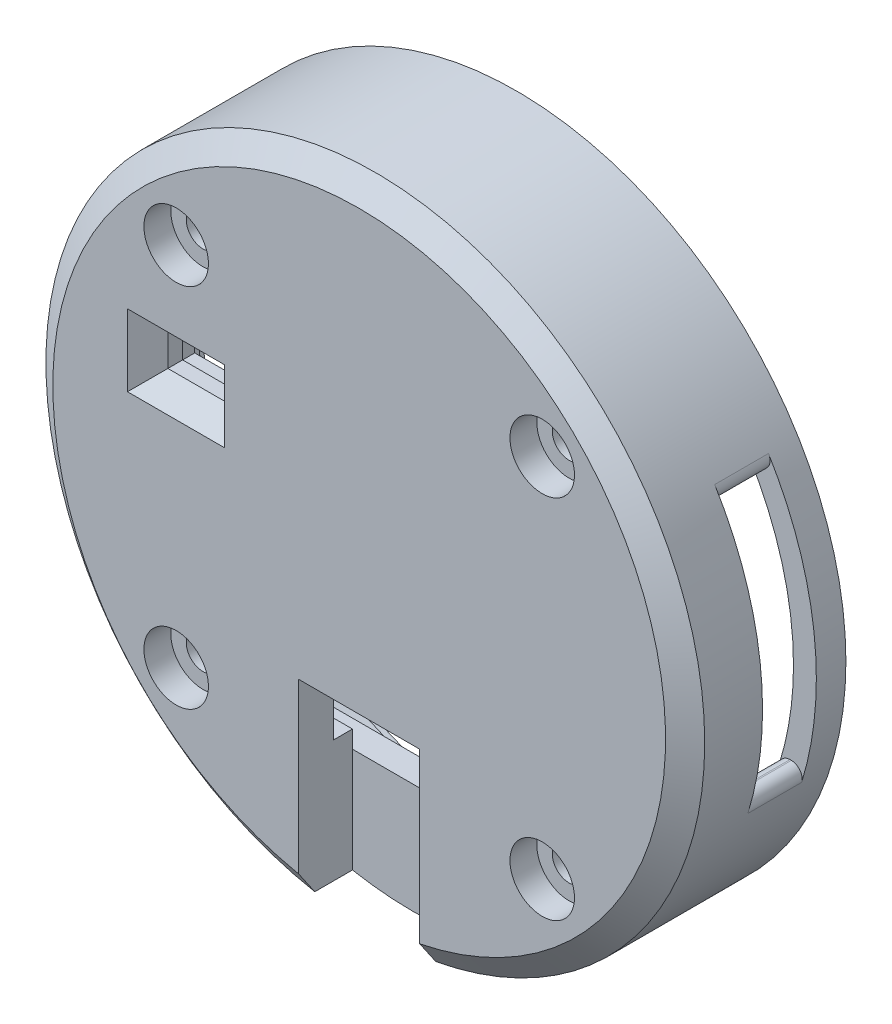
from build123d import *
from build123d.topology import SkipClean

# Parameters (mm, degrees)
EXTRUDE_3_DEPTH     = 11.7
SKETCH_2_5_R        = 23.6
SKETCH_2_5_R_2      = 22.8
EXTRUDE_4_DEPTH     = 10.7
SKETCH_2_6_R        = 2.6
SKETCH_2_6_W        = 4.2
SKETCH_2_6_H        = 2.343935591
EXTRUDE_5_DEPTH     = 2.6
EXTRUDE_6_DEPTH     = 4
SKETCH_2_9_R        = 2.6
SKETCH_2_9_R_2      = 1.25
SKETCH_2_9_R_3      = 2.4
SKETCH_2_9_W        = 8.7
SKETCH_2_9_H        = 5.343935591
SKETCH_2_9_W_2      = 6.7
SKETCH_2_9_H_2      = 3.343935591
EXTRUDE_7_DEPTH     = 4
EXTRUDE_8_DEPTH     = 6
EXTRUDE_10_DEPTH    = 8.6
CUT_EXTRUDE_1_DEPTH = 4
CUT_EXTRUDE_2_DEPTH = 9.5
EXTRUDE_9_DEPTH     = 5.5
SKETCH_2_15_R       = 2.4
SKETCH_2_15_R_2     = 1.25
CUT_EXTRUDE_3_DEPTH = 2
CHAMFER_2_SIZE      = 1.5
FILLET_2_R          = 0.8
FILLET_3_R          = 0.8
FILLET_4_R          = 0.8
FILLET_5_R          = 0.8
CHAMFER_3_SIZE      = 1.2
CHAMFER_3_SIZE2     = 1.713777608


with BuildPart() as part:
    # 草图2 → 凸台-拉伸3 (new body)
    with BuildSketch(Plane.XY):
        with BuildLine():
            ThreePointArc((21.633307653, 11.5), (-14.000099508, 20.105899974), (-18.290981384, -16.3))
            Line((-18.290981384, -16.3), (-17.066634115, -16.3))
            ThreePointArc((-17.066634115, -16.3), (-14.012358538, 18.989834339), (20.608493395, 11.5))
            Line((20.608493395, 11.5), (21.633307653, 11.5))
        make_face()
        with BuildLine():
            ThreePointArc((24.5, 0), (23.772526554, 5.925958256), (21.633307653, 11.5))
            Line((21.633307653, 11.5), (20.608493395, 11.5))
            ThreePointArc((20.608493395, 11.5), (22.839882269, 5.941361624), (23.6, 0))
            ThreePointArc((23.6, 0), (23.391840542, -3.1275863), (22.771034232, -6.2))
            Line((22.771034232, -6.2), (23.70253151, -6.2))
            ThreePointArc((23.70253151, -6.2), (24.29981504, -3.125538193), (24.5, 0))
        make_face()
        with BuildLine():
            ThreePointArc((18.290981384, -16.3), (21.595515305, -11.570813225), (23.70253151, -6.2))
            Line((23.70253151, -6.2), (22.771034232, -6.2))
            ThreePointArc((22.771034232, -6.2), (20.549025642, -11.605927157), (17.066634115, -16.3))
            Line((17.066634115, -16.3), (18.290981384, -16.3))
        make_face()
        with BuildLine():
            Line((4.5, -23.167002396), (4.5, -24.083189158))
            ThreePointArc((4.5, -24.083189158), (12.041665852, -21.336548069), (18.290981384, -16.3))
            Line((18.290981384, -16.3), (17.066634115, -16.3))
            ThreePointArc((17.066634115, -16.3), (11.316751178, -20.709687172), (4.5, -23.167002396))
        make_face()
        with BuildLine():
            Line((-4.5, -23.167002396), (-4.5, -24.083189158))
            ThreePointArc((-4.5, -24.083189158), (0, -24.5), (4.5, -24.083189158))
            Line((4.5, -24.083189158), (4.5, -23.167002396))
            ThreePointArc((4.5, -23.167002396), (0, -23.6), (-4.5, -23.167002396))
        make_face()
        with BuildLine():
            Line((-17.066634115, -16.3), (-18.290981384, -16.3))
            ThreePointArc((-18.290981384, -16.3), (-12.041665852, -21.336548069), (-4.5, -24.083189158))
            Line((-4.5, -24.083189158), (-4.5, -23.167002396))
            ThreePointArc((-4.5, -23.167002396), (-11.316751178, -20.709687172), (-17.066634115, -16.3))
        make_face()
    extrude(amount=-EXTRUDE_3_DEPTH)

    # 草图2<5> → 凸台-拉伸4 (add)
    with BuildSketch(Plane.XY):
        Circle(SKETCH_2_5_R)
        Circle(SKETCH_2_5_R_2, mode=Mode.SUBTRACT)
    extrude(amount=-EXTRUDE_4_DEPTH)

    # 草图2<6> → 凸台-拉伸5 (add)
    with BuildSketch(Plane.XY):
        with BuildLine():
            ThreePointArc((17.170905626, -15), (0, 22.8), (-17.170905626, -15))
            Line((-17.170905626, -15), (-15.810194979, -15))
            ThreePointArc((-15.810194979, -15), (-13.611805538, -11.011805538), (-11.413416097, -15))
            Line((-11.413416097, -15), (-4.5, -15))
            Line((-4.5, -15), (-4.5, -9.8))
            Line((-4.5, -9.8), (4.5, -9.8))
            Line((4.5, -9.8), (4.5, -15))
            Line((4.5, -15), (11.413416097, -15))
            ThreePointArc((11.413416097, -15), (13.611805538, -11.011805538), (15.810194979, -15))
            Line((15.810194979, -15), (17.170905626, -15))
        make_face()
        with Locations((-13.611805538, 13.611805538)):
            Circle(SKETCH_2_6_R, mode=Mode.SUBTRACT)
        with Locations((13.611805538, 13.611805538)):
            Circle(SKETCH_2_6_R, mode=Mode.SUBTRACT)
        with Locations((-13.63048294, 5.028032205)):
            Rectangle(SKETCH_2_6_W, SKETCH_2_6_H, mode=Mode.SUBTRACT)
    extrude(amount=-EXTRUDE_5_DEPTH)

    # 草图2<7> → 凸台-拉伸6 (add)
    with BuildSketch(Plane.XY):
        with BuildLine():
            ThreePointArc((-17.170905626, -15), (-16.569248581, -15.662056106), (-15.942082674, -16.3))
            Line((-15.942082674, -16.3), (-4.5, -16.3))
            Line((-4.5, -16.3), (-4.5, -15))
            Line((-4.5, -15), (-11.413416097, -15))
            ThreePointArc((-11.413416097, -15), (-13.611805538, -16.211805538), (-15.810194979, -15))
            Line((-15.810194979, -15), (-17.170905626, -15))
        make_face()
        with BuildLine():
            Line((4.5, -15), (4.5, -16.3))
            Line((4.5, -16.3), (15.942082674, -16.3))
            ThreePointArc((15.942082674, -16.3), (16.569248581, -15.662056106), (17.170905626, -15))
            Line((17.170905626, -15), (15.810194979, -15))
            ThreePointArc((15.810194979, -15), (13.611805538, -16.211805538), (11.413416097, -15))
            Line((11.413416097, -15), (4.5, -15))
        make_face()
    extrude(amount=-EXTRUDE_6_DEPTH)

    # 草图2<9> → 凸台-拉伸7 (add)
    # profile 1 of 9: a face of its own
    with BuildSketch(Plane.XY):
        with Locations((-13.611805538, 13.611805538)):
            Circle(SKETCH_2_9_R)
        with Locations((-13.611805538, 13.611805538)):
            Circle(SKETCH_2_9_R_2, mode=Mode.SUBTRACT)
    # profile 2 of 9: a face of its own
    with BuildSketch(Plane.XY):
        with Locations((13.611805538, 13.611805538)):
            Circle(SKETCH_2_9_R)
        with Locations((13.611805538, 13.611805538)):
            Circle(SKETCH_2_9_R_2, mode=Mode.SUBTRACT)
    # profile 3 of 9: a face of its own
    with BuildSketch(Plane.XY):
        with Locations((-13.611805538, 13.611805538)):
            Circle(SKETCH_2_9_R)
        with Locations((-13.611805538, 13.611805538)):
            Circle(SKETCH_2_9_R_3, mode=Mode.SUBTRACT)
    # profile 4 of 9: a face of its own
    with BuildSketch(Plane.XY):
        with Locations((13.611805538, 13.611805538)):
            Circle(SKETCH_2_9_R)
        with Locations((13.611805538, 13.611805538)):
            Circle(SKETCH_2_9_R_3, mode=Mode.SUBTRACT)
    # profile 5 of 9: a face of its own
    with BuildSketch(Plane.XY):
        with Locations((13.611805538, -13.611805538)):
            Circle(SKETCH_2_9_R)
        with Locations((13.611805538, -13.611805538)):
            Circle(SKETCH_2_9_R_3, mode=Mode.SUBTRACT)
    # profile 6 of 9: a face of its own
    with BuildSketch(Plane.XY):
        with Locations((-13.611805538, -13.611805538)):
            Circle(SKETCH_2_9_R)
        with Locations((-13.611805538, -13.611805538)):
            Circle(SKETCH_2_9_R_3, mode=Mode.SUBTRACT)
    # profile 7 of 9: a face of its own
    with BuildSketch(Plane.XY):
        with Locations((-13.611805538, -13.611805538)):
            Circle(SKETCH_2_9_R_3)
        with Locations((-13.611805538, -13.611805538)):
            Circle(SKETCH_2_9_R_2, mode=Mode.SUBTRACT)
    # profile 8 of 9: a face of its own
    with BuildSketch(Plane.XY):
        with Locations((13.611805538, -13.611805538)):
            Circle(SKETCH_2_9_R_3)
        with Locations((13.611805538, -13.611805538)):
            Circle(SKETCH_2_9_R_2, mode=Mode.SUBTRACT)
    # profile 9 of 9: a face of its own
    with BuildSketch(Plane.XY):
        with Locations((-12.88048294, 5.028032205)):
            Rectangle(SKETCH_2_9_W, SKETCH_2_9_H)
        with Locations((-12.88048294, 5.028032205)):
            Rectangle(SKETCH_2_9_W_2, SKETCH_2_9_H_2, mode=Mode.SUBTRACT)
    extrude(amount=-EXTRUDE_7_DEPTH)

    # 草图2<11> → 凸台-拉伸8 (add)
    with BuildSketch(Plane.XY):
        with BuildLine():
            ThreePointArc((-15.942082674, -16.3), (-9.833120113, -20.570603998), (-2.673250745, -22.642741231))
            Line((-2.673250745, -22.642741231), (-3.766025404, -20.75))
            ThreePointArc((-3.766025404, -20.75), (-3.766025404, -19.75), (-2.9, -19.25))
            Line((-2.9, -19.25), (2.9, -19.25))
            ThreePointArc((2.9, -19.25), (3.766025404, -19.75), (3.766025404, -20.75))
            Line((3.766025404, -20.75), (2.673250745, -22.642741231))
            ThreePointArc((2.673250745, -22.642741231), (9.833120113, -20.570603998), (15.942082674, -16.3))
            Line((15.942082674, -16.3), (-15.942082674, -16.3))
        make_face()
    extrude(amount=-EXTRUDE_8_DEPTH)

    # 草图2<17> → 凸台-拉伸10 (add)
    with BuildSketch(Plane.XY):
        with BuildLine():
            Line((-3.766025404, -20.75), (-2.673250745, -22.642741231))
            ThreePointArc((-2.673250745, -22.642741231), (0, -22.8), (2.673250745, -22.642741231))
            Line((2.673250745, -22.642741231), (3.766025404, -20.75))
            ThreePointArc((3.766025404, -20.75), (3.766025404, -19.75), (2.9, -19.25))
            Line((2.9, -19.25), (-2.9, -19.25))
            ThreePointArc((-2.9, -19.25), (-3.766025404, -19.75), (-3.766025404, -20.75))
        make_face()
    extrude(amount=-EXTRUDE_10_DEPTH)

    # 草图2<10> → 切除-拉伸1 (cut)
    with BuildSketch(Plane.XY):
        with BuildLine():
            ThreePointArc((-4.5, -24.083189158), (0, -24.5), (4.5, -24.083189158))
            Line((4.5, -24.083189158), (4.5, -16.3))
            Line((4.5, -16.3), (-4.5, -16.3))
            Line((-4.5, -16.3), (-4.5, -24.083189158))
        make_face()
    extrude(amount=-CUT_EXTRUDE_1_DEPTH, mode=Mode.SUBTRACT)

    # 草图2<13> → 切除-拉伸2 (cut)
    with BuildSketch(Plane.XY):
        with BuildLine():
            ThreePointArc((24.5, 0), (23.772526554, 5.925958256), (21.633307653, 11.5))
            Line((21.633307653, 11.5), (20.608493395, 11.5))
            ThreePointArc((20.608493395, 11.5), (22.839882269, 5.941361624), (23.6, 0))
            ThreePointArc((23.6, 0), (23.391840542, -3.1275863), (22.771034232, -6.2))
            Line((22.771034232, -6.2), (23.70253151, -6.2))
            ThreePointArc((23.70253151, -6.2), (24.29981504, -3.125538193), (24.5, 0))
        make_face()
        with BuildLine():
            ThreePointArc((23.6, 0), (22.839882269, 5.941361624), (20.608493395, 11.5))
            Line((20.608493395, 11.5), (19.687305555, 11.5))
            ThreePointArc((19.687305555, 11.5), (22.00807314, 5.956904958), (22.8, 0))
            ThreePointArc((22.8, 0), (22.584185983, -3.129623536), (21.940829519, -6.2))
            Line((21.940829519, -6.2), (22.771034232, -6.2))
            ThreePointArc((22.771034232, -6.2), (23.391840542, -3.1275863), (23.6, 0))
        make_face()
    extrude(amount=-CUT_EXTRUDE_2_DEPTH, mode=Mode.SUBTRACT)

    # 草图2<14> → 凸台-拉伸9 (add)
    with SkipClean():  # the faces are left unmerged after this step: merging them gives an invalid solid
        with BuildSketch(Plane.XY):
            with BuildLine():
                ThreePointArc((24.5, 0), (23.772526554, 5.925958256), (21.633307653, 11.5))
                Line((21.633307653, 11.5), (20.608493395, 11.5))
                ThreePointArc((20.608493395, 11.5), (22.839882269, 5.941361624), (23.6, 0))
                ThreePointArc((23.6, 0), (23.391840542, -3.1275863), (22.771034232, -6.2))
                Line((22.771034232, -6.2), (23.70253151, -6.2))
                ThreePointArc((23.70253151, -6.2), (24.29981504, -3.125538193), (24.5, 0))
            make_face()
            with BuildLine():
                ThreePointArc((23.6, 0), (22.839882269, 5.941361624), (20.608493395, 11.5))
                Line((20.608493395, 11.5), (19.687305555, 11.5))
                ThreePointArc((19.687305555, 11.5), (22.00807314, 5.956904958), (22.8, 0))
                ThreePointArc((22.8, 0), (22.584185983, -3.129623536), (21.940829519, -6.2))
                Line((21.940829519, -6.2), (22.771034232, -6.2))
                ThreePointArc((22.771034232, -6.2), (23.391840542, -3.1275863), (23.6, 0))
            make_face()
        extrude(amount=-EXTRUDE_9_DEPTH)

    # 草图2<15> → 切除-拉伸3 (cut)
    # profile 1 of 4: a face of its own
    with SkipClean():  # the faces are left unmerged after this step: merging them gives an invalid solid
        with BuildSketch(Plane.XY):
            with Locations((-13.611805538, 13.611805538)):
                Circle(SKETCH_2_15_R)
            with Locations((-13.611805538, 13.611805538)):
                Circle(SKETCH_2_15_R_2, mode=Mode.SUBTRACT)
        # profile 2 of 4: a face of its own
        with BuildSketch(Plane.XY):
            with Locations((13.611805538, 13.611805538)):
                Circle(SKETCH_2_15_R)
            with Locations((13.611805538, 13.611805538)):
                Circle(SKETCH_2_15_R_2, mode=Mode.SUBTRACT)
        # profile 3 of 4: a face of its own
        with BuildSketch(Plane.XY):
            with Locations((13.611805538, -13.611805538)):
                Circle(SKETCH_2_15_R)
            with Locations((13.611805538, -13.611805538)):
                Circle(SKETCH_2_15_R_2, mode=Mode.SUBTRACT)
        # profile 4 of 4: a face of its own
        with BuildSketch(Plane.XY):
            with Locations((-13.611805538, -13.611805538)):
                Circle(SKETCH_2_15_R)
            with Locations((-13.611805538, -13.611805538)):
                Circle(SKETCH_2_15_R_2, mode=Mode.SUBTRACT)
        extrude(amount=-CUT_EXTRUDE_3_DEPTH, mode=Mode.SUBTRACT)

    # 倒角2
    chamfer_2_edges = [part.edges().sort_by_distance(p)[0] for p in [
        (-13.63048294, 6.2, 0),
        (-15.73048294, 5.028032204, 0),
        (-13.63048294, 3.856064409, 0),
        (-11.53048294, 5.028032204, 0),
    ]]
    chamfer(chamfer_2_edges, length=CHAMFER_2_SIZE)

    # 圆角2
    # the kernel refuses this fillet: 0.8 mm, written as the material it takes off along each edge
    with BuildSketch(Plane(origin=(21.633307653, 11.5, -5.5), x_dir=(-0.49438880167130195, 0.8692408830594739, 0), z_dir=(0, 0, -1))) as fillet_2_piece_1:
        with BuildLine():
            CenterArc((1.37516546, -0.79967434), FILLET_2_R, 88.365106431, 121.26434887)
            Line((0.679772753, -1.195185381), (0, 0))
            ThreePointArc((0, 0), (0.698994891, 0.009973333), (1.397989783, 0))
        make_face()
    extrude(amount=4, mode=Mode.SUBTRACT)

    # 圆角3
    # the kernel refuses this fillet: 0.8 mm, written as the material it takes off along each edge
    with BuildSketch(Plane(origin=(23.70253151, -6.2, -5.5), x_dir=(-0.27427627228974394, -0.9616509379493383, 0), z_dir=(0, 0, -1))) as fillet_3_piece_1:
        with BuildLine():
            CenterArc((1.060018672, 0.799806516), FILLET_3_R, 164.081110631, 107.179044823)
            Line((0.290697921, 1.019227534), (0, 0))
            ThreePointArc((0, 0), (0.538806171, -0.005925453), (1.077612342, 0))
        make_face()
    extrude(amount=4, mode=Mode.SUBTRACT)

    # 圆角4
    fillet_4_edges = [part.edges().sort_by_distance(p)[0] for p in [
        (21.940829519, -6.2, -7.5),
    ]]
    fillet(fillet_4_edges, radius=FILLET_4_R)

    # 圆角5
    fillet_5_edges = [part.edges().sort_by_distance(p)[0] for p in [
        (19.687305555, 11.5, -7.5),
    ]]
    fillet(fillet_5_edges, radius=FILLET_5_R)

    # 倒角3
    chamfer_3_edges = [part.edges().sort_by_distance(p)[0] for p in [
        (-14.000099508, 20.105899974, 0),
    ]]
    chamfer_3_side = [part.faces().sort_by_distance(p)[0] for p in [
        (18.290981384, 16.3, -5.85),
    ]]
    chamfer(chamfer_3_edges, length=CHAMFER_3_SIZE, length2=CHAMFER_3_SIZE2, reference=chamfer_3_side[0])


solid = part.part
